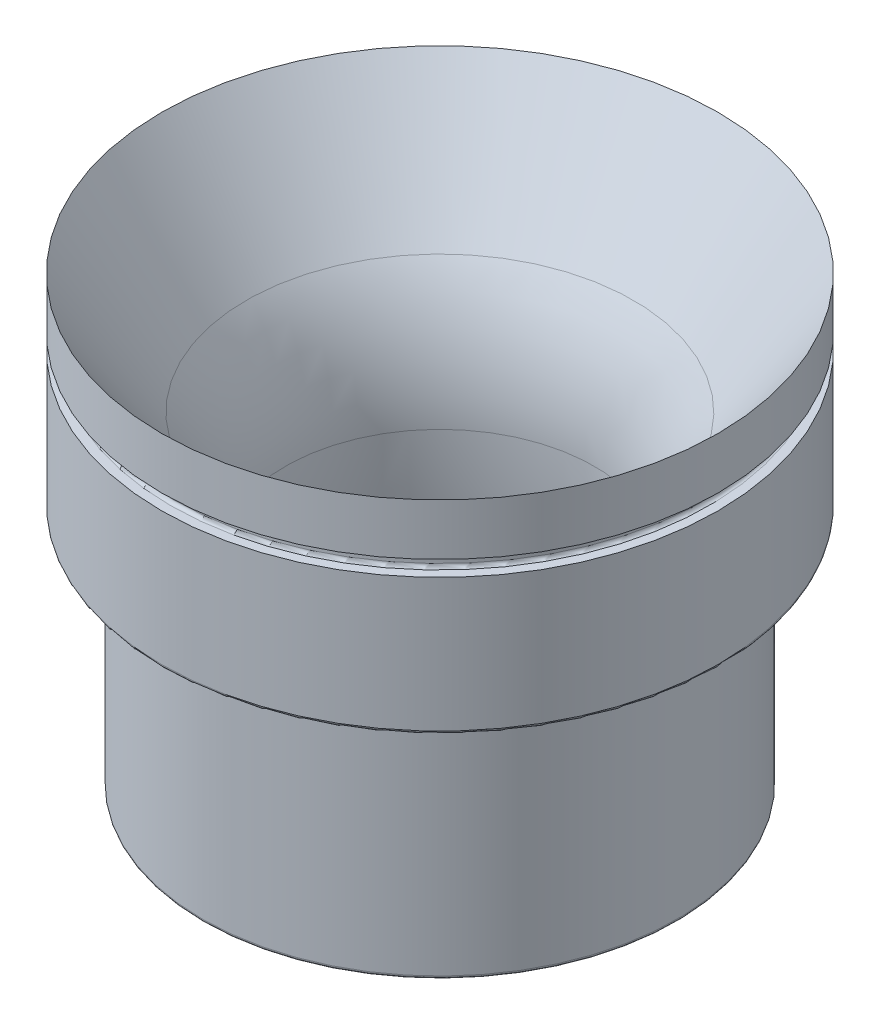
from build123d import *

# Parameters (mm, degrees)
SKETCH6_W     = 1.51765
SKETCH6_H     = 1.905
TOOL_RADIUS_R = 0.4064


with BuildPart() as part:
    # Sketch4 → Revolve1 (revolve)
    with BuildSketch(Plane(origin=(0, 0, 0), x_dir=(0, 0, -1), z_dir=(1, 0, 0))):
        with BuildLine():
            Line((34.28365, 0), (23.873214979, -14.867642025))
            ThreePointArc((23.873214979, -14.867642025), (20.284368924, -22.14510191), (19.05, -30.164925582))
            ThreePointArc((19.05, -30.164925582), (19.864190646, -42.592331251), (22.292843289, -54.80727965))
            Line((22.292843289, -54.80727965), (29.1846, -54.80727965))
            Line((29.1846, -54.80727965), (29.1846, -25.059525582))
            Line((29.1846, -25.059525582), (34.28365, -25.059525582))
            Line((34.28365, -25.059525582), (34.28365, 0))
        make_face()
    revolve(axis=Axis((0, 0, 0), (0, -1, 0)))

    # Sketch6 → Spring Groove (revolve, cut)
    with BuildSketch(Plane(origin=(0, 0, 0), x_dir=(0, 0, -1), z_dir=(1, 0, 0))):
        with Locations((33.524825, -7.3025)):
            Rectangle(SKETCH6_W, SKETCH6_H)
    revolve(axis=Axis((0, 11.364369063, 0), (0, -1, 0)), mode=Mode.SUBTRACT)

    # Tool Radius
    tool_radius_edges = [part.edges().sort_by_distance(p)[0] for p in [
        (0, -54.80727965, 29.1846),
        (0, -25.059525582, 34.28365),
        (0, -6.35, 32.766),
        (0, -8.255, 32.766),
        (0, -25.059525582, 29.1846),
    ]]
    fillet(tool_radius_edges, radius=TOOL_RADIUS_R)


solid = part.part
